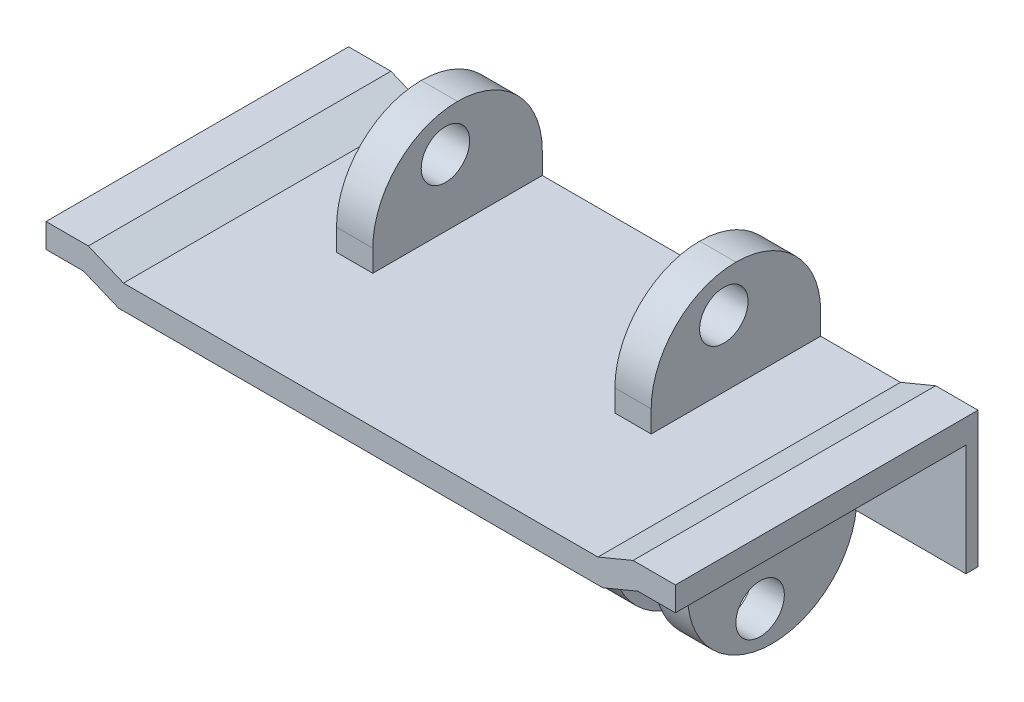
from build123d import *

# Parameters (mm, degrees)
SKETCH2_W                 = 5
SKETCH2_H                 = 15
BOSS_EXTRUDE1_DEPTH       = 14
BOSS_EXTRUDE1_2_DEPTH     = 14
BOSS_EXTRUDE3_DEPTH       = 25
SKETCH5_W                 = 3
SKETCH5_H                 = 8.8
BOSS_EXTRUDE4_DEPTH       = 14
SKETCH7_W                 = 3
SKETCH7_H                 = 15
BOSS_EXTRUDE5_DEPTH       = 14
SKETCH15_W                = 0.3
SKETCH15_H                = 14
CUT_EXTRUDE2_DEPTH        = 15
SKETCH16_W                = 0.15
SKETCH16_H                = 14
CUT_EXTRUDE3_DEPTH        = 15
FILLET1_R                 = 7
F_4_0MM_DOWEL_HOLE2_D     = 4
FILLET2_R                 = 7
F_4_0MM_DOWEL_HOLE1_D     = 4
F_4_0MM_DOWEL_HOLE1_DEPTH = 26
F_4_0MM_DOWEL_HOLE1_TIP   = 1.201721238
BOSS_EXTRUDE6_DEPTH       = 1
CUT_EXTRUDE4_DEPTH        = 2.4


with BuildPart() as part:
    # Sketch2 → Boss-Extrude1 (new body)
    with BuildSketch(Plane.XY):
        with Locations((-7.5, -1.5)):
            Rectangle(SKETCH2_W, SKETCH2_H)
    extrude(amount=BOSS_EXTRUDE1_DEPTH)



with BuildPart() as body_2:
    # Sketch2 → Boss-Extrude1 2 (new body)
    with BuildSketch(Plane.XY):
        with Locations((7.5, -1.5)):
            Rectangle(SKETCH2_W, SKETCH2_H)
    extrude(amount=BOSS_EXTRUDE1_2_DEPTH)


with BuildPart() as part_1:
    add(part.part)

    add(body_2.part)  # Boss-Extrude3 merges body 2
    # Sketch4 → Boss-Extrude3 (add)
    with BuildSketch(Plane.XY):
        Polygon((-10, 6), (-20, 6), (-22.901603942, 7.206366686), (-26, 7.206366686), (-26, 9.206366686), (-22.502408858, 9.206366686), (-19.600804916, 8), (-10, 8), (10, 8), (19.600804916, 8), (22.502408858, 9.206366686), (26, 9.206366686), (26, 7.206366686), (22.901603942, 7.206366686), (20, 6), (10, 6), align=None)
    extrude(amount=BOSS_EXTRUDE3_DEPTH)

    # Sketch5 → Boss-Extrude4 (add)
    with BuildSketch(Plane.XY):
        with Locations((-11.5, 12.4)):
            Rectangle(SKETCH5_W, SKETCH5_H)
        with Locations((11.5, 12.4)):
            Rectangle(SKETCH5_W, SKETCH5_H)
    extrude(amount=BOSS_EXTRUDE4_DEPTH)

    # Sketch7 → Boss-Extrude5 (add)
    with BuildSketch(Plane.XY):
        with Locations((-14.5, -1.5)):
            Rectangle(SKETCH7_W, SKETCH7_H)
        with Locations((14.5, -1.5)):
            Rectangle(SKETCH7_W, SKETCH7_H)
    extrude(amount=BOSS_EXTRUDE5_DEPTH)

    # Sketch15 → Cut-Extrude2 (cut)
    with BuildSketch(Plane.XZ.offset(9)):
        with Locations((-9.85, 7)):
            Rectangle(SKETCH15_W, SKETCH15_H)
        with Locations((9.85, 7)):
            Rectangle(SKETCH15_W, SKETCH15_H)
        with Locations((-13.15, 7)):
            Rectangle(SKETCH15_W, SKETCH15_H)
        with Locations((13.15, 7)):
            Rectangle(SKETCH15_W, SKETCH15_H)
    extrude(amount=-CUT_EXTRUDE2_DEPTH, mode=Mode.SUBTRACT)

    # Sketch16 → Cut-Extrude3 (cut)
    with BuildSketch(Plane.XZ.offset(9)):
        with Locations((-5.075, 7)):
            Rectangle(SKETCH16_W, SKETCH16_H)
        with Locations((5.075, 7)):
            Rectangle(SKETCH16_W, SKETCH16_H)
    extrude(amount=-CUT_EXTRUDE3_DEPTH, mode=Mode.SUBTRACT)

    # Fillet1
    fillet1_edges = [part_1.edges().sort_by_distance(p)[0] for p in [
        (7.425, -9, 0),
        (7.425, -9, 14),
        (-7.425, -9, 0),
        (-7.425, -9, 14),
        (-14.65, -9, 0),
        (-14.65, -9, 14),
        (14.65, -9, 14),
        (14.65, -9, 0),
    ]]
    fillet(fillet1_edges, radius=FILLET1_R - 0.0001)  # a hair under: the kernel refuses the full size

    # Ø4.0mm Dowel Hole2 (through all)
    with Locations(Plane(origin=(16, 0, 0), x_dir=(0, 0, -1), z_dir=(1, 0, 0))):
        with Locations((-8, -6)):
            Hole(F_4_0MM_DOWEL_HOLE2_D / 2)

    # Fillet2
    fillet2_edges = [part_1.edges().sort_by_distance(p)[0] for p in [
        (-11.5, 16.8, 0),
        (-11.5, 16.8, 14),
        (11.5, 16.8, 0),
        (11.5, 16.8, 14),
    ]]
    fillet(fillet2_edges, radius=FILLET2_R - 0.0001)  # a hair under: the kernel refuses the full size

    # Ø4.0mm Dowel Hole1
    with Locations(Plane(origin=(13, 0, 0), x_dir=(0, 0, -1), z_dir=(1, 0, 0))):
        with Locations((-8, 13.5)):
            Hole(F_4_0MM_DOWEL_HOLE1_D / 2, depth=F_4_0MM_DOWEL_HOLE1_DEPTH)
            with Locations((0, 0, -(F_4_0MM_DOWEL_HOLE1_DEPTH + F_4_0MM_DOWEL_HOLE1_TIP / 2))):  # 118° drill point
                Cone(0, F_4_0MM_DOWEL_HOLE1_D / 2, F_4_0MM_DOWEL_HOLE1_TIP, mode=Mode.SUBTRACT)

    # Sketch14 → Boss-Extrude6 (add)
    with BuildSketch(Plane.XY):
        Polygon((-22.901603942, 7.206366686), (-26, 7.206366686), (-26, -2), (-16, -2), (-16, 6), (-20, 6), align=None)
        Polygon((20, 6), (16, 6), (16, -2), (26, -2), (26, 7.206366686), (22.901603942, 7.206366686), align=None)
    extrude(amount=BOSS_EXTRUDE6_DEPTH)

    # Sketch18 → Cut-Extrude4 (cut)
    with BuildSketch(Plane(origin=(-5.15, 0, 0), x_dir=(0, 0, -1), z_dir=(1, 0, 0))):
        Polygon((-6.110899152, -3.235107358), (-9.449916842, -2.981544355), (-11.33901769, -5.746436996), (-9.889100848, -8.764892642), (-6.550083158, -9.018455645), (-4.66098231, -6.253563004), align=None)
    cut_extrude4 = extrude(amount=-CUT_EXTRUDE4_DEPTH, mode=Mode.SUBTRACT)

    # Mirror1: Cut-Extrude4 across plane
    add(cut_extrude4.mirror(Plane(origin=(0, 0, 0), x_dir=(0, 0, 1), z_dir=(1, 0, 0))), mode=Mode.SUBTRACT)


solid = part_1.part
